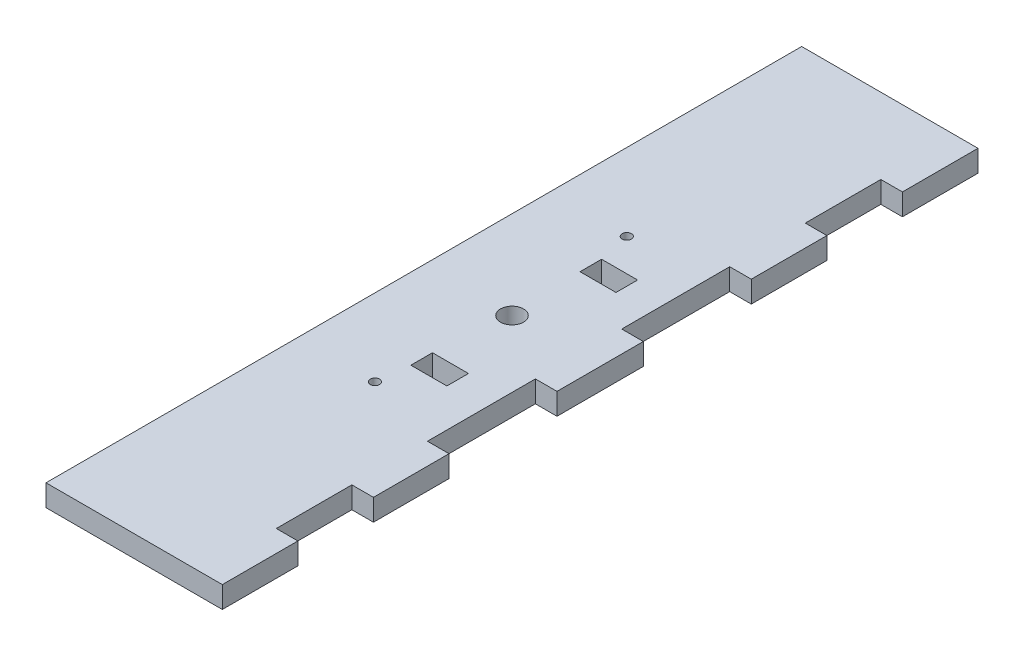
from build123d import *

# Parameters (mm, degrees)
SKETCH1_W           = 49
SKETCH1_H           = 210
SKETCH1_R           = 3.2
BOSS_EXTRUDE1_DEPTH = 6
SKETCH2_W           = 6
SKETCH2_H           = 21
SKETCH2_H_2         = 30
CUT_EXTRUDE1_DEPTH  = 108.987267768
SKETCH3_W           = 10
SKETCH3_H           = 6
CUT_EXTRUDE2_DEPTH  = 108.987267768
SKETCH4_R           = 1.3
CUT_EXTRUDE3_DEPTH  = 108.987267768


with BuildPart() as part:
    # Sketch1 → Boss-Extrude1 (new body)
    with BuildSketch(Plane(origin=(0, 0, 0), x_dir=(1, 0, 0), z_dir=(0, 1, 0))):
        Rectangle(SKETCH1_W, SKETCH1_H)
        Circle(SKETCH1_R, mode=Mode.SUBTRACT)
    extrude(amount=BOSS_EXTRUDE1_DEPTH)

    # Sketch2 → Cut-Extrude1 (cut, through all)
    with BuildSketch(Plane(origin=(0, 6, 0), x_dir=(1, 0, 0), z_dir=(0, 1, 0))):
        with Locations((21.5, 73.5)):
            Rectangle(SKETCH2_W, SKETCH2_H)
        with Locations((21.5, 27)):
            Rectangle(SKETCH2_W, SKETCH2_H_2)
        with Locations((21.5, -27)):
            Rectangle(SKETCH2_W, SKETCH2_H_2)
        with Locations((21.5, -73.5)):
            Rectangle(SKETCH2_W, SKETCH2_H)
    extrude(amount=-CUT_EXTRUDE1_DEPTH, mode=Mode.SUBTRACT)

    # Sketch3 → Cut-Extrude2 (cut, through all)
    with BuildSketch(Plane(origin=(0, 6, 0), x_dir=(1, 0, 0), z_dir=(0, 1, 0))):
        with Locations((2.9, -23)):
            Rectangle(SKETCH3_W, SKETCH3_H)
        with Locations((3.9, 23)):
            Rectangle(SKETCH3_W, SKETCH3_H)
    extrude(amount=-CUT_EXTRUDE2_DEPTH, mode=Mode.SUBTRACT)

    # Sketch4 → Cut-Extrude3 (cut, through all)
    with BuildSketch(Plane(origin=(0, 6, 0), x_dir=(1, 0, 0), z_dir=(0, 1, 0))):
        with Locations((-3.1, -35)):
            Circle(SKETCH4_R)
        with Locations((-3.1, 35)):
            Circle(SKETCH4_R)
    extrude(amount=-CUT_EXTRUDE3_DEPTH, mode=Mode.SUBTRACT)


solid = part.part
